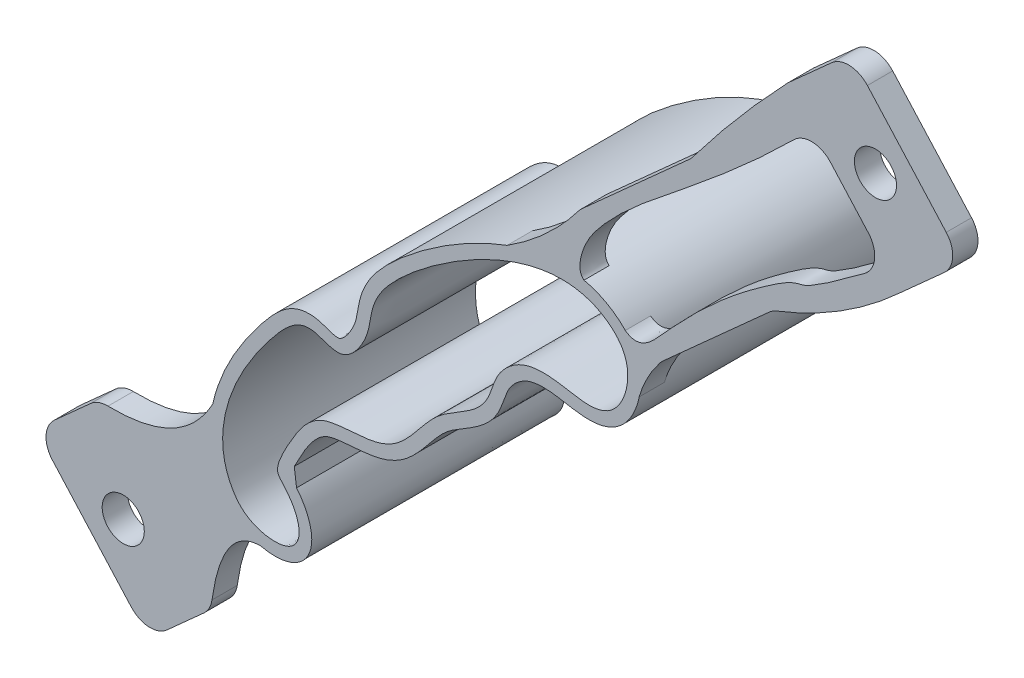
from build123d import *

# Parameters (mm, degrees)
AUFSATZ_LINEAR_AUSTRAGEN1_DEPTH = 30
SKIZZE4_R                       = 2.5
AUFSATZ_LINEAR_AUSTRAGEN2_DEPTH = 3
VERRUNDUNG3_R                   = 3
VERRUNDUNG4_R                   = 3
VERRUNDUNG5_START               = 27
VERRUNDUNG5_DEPTH               = 4


with BuildPart() as part:
    # Skizze1 → Aufsatz-Linear austragen1 (new body)
    with BuildSketch(Plane.XY):
        with BuildLine():
            Line((17.805483873, 75.346365063), (18.075577559, 73.275148617))
            add(Edge.make_bspline(
                [(17.805483873, 75.346365063), (17.901787388, 75.543952663), (18.098918872, 75.928420098), (18.531592516, 76.745922277), (19.053767391, 77.662901227), (19.685962473, 78.616842785), (20.310394137, 79.376011662), (20.917428897, 79.928504014), (21.492474627, 80.28589167), (22.109068164, 80.509254303), (23.080296979, 80.686536991), (24.274002487, 80.792069272), (25.639469144, 80.88753125), (27.13062438, 81.061916228), (28.733960632, 81.429483549), (30.390920227, 82.228106161), (31.667071802, 83.250840335), (32.715273654, 84.341017606), (33.90438164, 85.776346699), (35.21989003, 87.417041193), (36.388894712, 88.376958169), (37.828749756, 89.23417776), (39.042200601, 89.957344071), (40.332865121, 90.878925264), (41.378387834, 91.938856642), (42.076803149, 93.079988833), (42.41988679, 93.870983306), (42.670764701, 94.562859448), (42.87474209, 95.148772987), (43.055555842, 95.607525294), (43.288356196, 96.071310095), (43.700040542, 96.667894597), (44.313403567, 97.275033099), (45.004419797, 97.746706325), (45.686220273, 98.039769447), (46.733537315, 98.276019436), (48.06498212, 98.27185138), (49.645725432, 98.017934336), (51.110776669, 97.742231177), (52.784433655, 97.564727754), (54.439751425, 97.737840698), (55.851643862, 98.367684179), (57.087502619, 99.337094371), (58.089476068, 100.788884726), (58.77744943, 102.731587817), (58.937793672, 104.466388951), (58.765090388, 105.888534056), (58.432222636, 106.987744731), (57.91107896, 107.96268635), (57.085341572, 109.036026358), (55.970688846, 110.010762591), (54.555824749, 110.884812204), (53.032806254, 111.494601963), (50.944024423, 111.969000483), (48.291713956, 112.011252638), (45.144185458, 111.42403095), (42.059703724, 110.372227973), (38.088387574, 108.522190188), (33.528398131, 105.653716785), (29.258804569, 102.161178369), (27.169462549, 99.807184599), (26.139829606, 98.031380667), (25.661886766, 96.761270053), (25.418258003, 95.659338492), (25.233041872, 94.508783911), (25.043849953, 93.597827676), (24.323346092, 92.232835475), (23.646211225, 91.479948899), (23.296577273, 91.235583432), (23.123227372, 91.16685541), (23.080052081, 91.156135532), (22.971148478, 91.147507371), (22.71775014, 91.170129221), (22.420037015, 91.232610881), (22.02112936, 91.348290824), (21.439728086, 91.56192735), (20.319975171, 91.94215213), (18.533359684, 91.937418533), (16.906456684, 91.157887553), (15.583323175, 90.015658963), (14.178361442, 88.430542663), (12.443551899, 86.157895786), (10.677187512, 83.434272528), (9.244281861, 80.585632761), (8.205950778, 77.61119912), (7.786702128, 75.05742733), (7.808347555, 72.98945391), (8.032696812, 71.439764368), (8.413328925, 70.172194256), (8.84839224, 69.183752531), (9.354729082, 68.241171613), (10.09109392, 67.211309317), (11.187482131, 66.274817628), (12.532239947, 65.501001854), (13.948201625, 65.085459517), (15.430634646, 64.943914962), (16.587298552, 65.02136804), (17.636042911, 65.323546314), (18.512724633, 65.862353891), (19.137723882, 66.468854864), (19.610701751, 67.27724727), (19.904720592, 68.314381998), (19.892895413, 69.433557605), (19.62720783, 70.557548958), (19.210952041, 71.571661352), (18.77104499, 72.344471852), (18.357477737, 72.9260159), (18.174019412, 73.155724767), (18.075577559, 73.275148617)],
                knots=[0.512604297, 0.512604297, 0.512604297, 0.512604297, 0.516386221, 0.520168144, 0.527731992, 0.535295839, 0.542859686, 0.550423533, 0.557987381, 0.565551228, 0.573115075, 0.580678922, 0.58824277, 0.595806617, 0.603370464, 0.610934311, 0.618498159, 0.626062006, 0.633625853, 0.648753548, 0.663881242, 0.671445089, 0.679008937, 0.686572784, 0.694136631, 0.697918555, 0.701700478, 0.705482402, 0.709264326, 0.713046249, 0.716828173, 0.72439202, 0.731955867, 0.739519715, 0.747083562, 0.754647409, 0.769775104, 0.777338951, 0.784902798, 0.792466645, 0.800030493, 0.803812416, 0.80759434, 0.815158187, 0.822722034, 0.830285882, 0.834067805, 0.837849729, 0.841631653, 0.845413576, 0.852977423, 0.860541271, 0.868105118, 0.875668965, 0.89079666, 0.905924354, 0.921052049, 0.936179743, 0.966435132, 0.996690521, 1.02694591, 1.042073605, 1.057201299, 1.072328994, 1.087456688, 1.117712077, 1.147967466, 1.163095161, 1.178222855, 1.185786702, 1.19335055, 1.200914397, 1.208478244, 1.216042091, 1.223605939, 1.238733633, 1.253861328, 1.268989022, 1.284116717, 1.299244411, 1.314372106, 1.3294998, 1.344627495, 1.359755189, 1.374882884, 1.390010578, 1.397574425, 1.405138273, 1.41270212, 1.416484043, 1.420265967, 1.427829814, 1.431611738, 1.435393662, 1.442957509, 1.446739432, 1.450521356, 1.45430328, 1.456194242, 1.458085203, 1.459976165, 1.461867127, 1.465649051, 1.469430974, 1.473212898, 1.476994821, 1.478885783, 1.480776745, 1.480776745, 1.480776745, 1.480776745], degree=3))
        make_face()
        with BuildLine():
            add(Edge.make_bspline(
                [(30.233446723, 100.85101166), (29.190718101, 99.845008641), (27.765699565, 98.12645383), (26.936215872, 95.93535377), (26.769511384, 94.496146017), (26.52160366, 93.439814031), (26.068630401, 92.242965953), (25.249654064, 90.925989184), (24.269657958, 90.040562016), (23.650689888, 89.737001754), (23.19494828, 89.649334347), (22.644748797, 89.649713176), (21.887332557, 89.804985595), (21.124450197, 90.078494556), (20.287835153, 90.381594462), (19.171109962, 90.487227818), (17.982257511, 90.051113115), (16.846082884, 89.151249444), (15.53435029, 87.719466296), (13.83011404, 85.518132051), (12.063775475, 82.837237868), (10.650946038, 80.059543546), (9.651745831, 77.204790774), (9.201192972, 74.345819411), (9.396957061, 72.014438091), (9.988032593, 70.23378912), (10.637213627, 68.981161987), (11.641794285, 67.728214108), (13.263152214, 66.798679724), (14.815535673, 66.464214337), (16.039060928, 66.470178917), (16.924453393, 66.658751519), (17.790619508, 67.133799808), (18.365534145, 68.107408678), (18.412101029, 69.051577314), (18.244840981, 69.939334243), (17.91824725, 70.791351155), (17.479009049, 71.594269096), (16.95111228, 72.298581099), (16.463933023, 72.846487733), (16.084747463, 73.293634939), (15.88387409, 73.623826612), (15.824645547, 73.837560692), (15.816404613, 74.20229001), (15.912908348, 74.6794492), (16.170769348, 75.428392693), (16.697567965, 76.499933446), (17.39002436, 77.790610668), (18.323921033, 79.338878035), (19.334068193, 80.594466397), (20.456142208, 81.441830296), (21.653650593, 82.004197457), (23.681330256, 82.282305979), (26.04358602, 82.39634833), (27.929507931, 82.762544559), (29.318087614, 83.33890246), (30.472655664, 84.194343632), (31.789899452, 85.518938709), (32.914603711, 86.974583556), (34.064639599, 88.301439685), (34.958920289, 89.162802524), (35.976820988, 89.878480204), (37.14145258, 90.569458724), (38.342123511, 91.290612222), (39.498869063, 92.142849231), (40.345635916, 93.072353549), (40.845449209, 93.990433423), (41.20350496, 94.883013777), (41.543861114, 95.938704646), (42.038536602, 96.949210355), (42.760600152, 97.883218551), (43.928501206, 98.920925077), (45.580026595, 99.689675342), (47.522867565, 99.80795981), (49.247180718, 99.616760163), (50.656851813, 99.347806037), (52.149277438, 99.113967021), (53.436817064, 99.114424317), (54.475229345, 99.37965313), (55.490380949, 99.901029126), (56.454745031, 100.962161128), (57.16413879, 102.532256924), (57.456823643, 104.25926661), (57.269451624, 106.026090864), (56.422107963, 107.570403532), (55.286075865, 108.640053794), (54.070735412, 109.441423108), (52.748525558, 110.006760908), (50.89875978, 110.458620973), (48.47026287, 110.517941364), (45.475388666, 109.959560771), (42.46947693, 108.919928117), (38.550166207, 107.063182864), (34.022071296, 104.162471948), (31.276175345, 101.85701468), (30.233446723, 100.85101166)],
                knots=[0, 0, 0, 0, 0.03125, 0.0625, 0.09375, 0.109375, 0.125, 0.15625, 0.171875, 0.1875, 0.1953125, 0.203125, 0.21875, 0.234375, 0.25, 0.265625, 0.28125, 0.296875, 0.3125, 0.328125, 0.34375, 0.359375, 0.375, 0.390625, 0.40625, 0.4140625, 0.421875, 0.4296875, 0.4375, 0.4453125, 0.44921875, 0.453125, 0.45703125, 0.4609375, 0.46484375, 0.46875, 0.47265625, 0.4765625, 0.48046875, 0.484375, 0.48828125, 0.4921875, 0.49609375, 0.5, 0.50390625, 0.5078125, 0.515625, 0.5234375, 0.53125, 0.546875, 0.5546875, 0.5625, 0.578125, 0.59375, 0.6015625, 0.609375, 0.6171875, 0.625, 0.640625, 0.6484375, 0.65625, 0.6640625, 0.671875, 0.6796875, 0.6875, 0.6953125, 0.69921875, 0.703125, 0.7109375, 0.71875, 0.7265625, 0.734375, 0.75, 0.765625, 0.7734375, 0.78125, 0.7890625, 0.796875, 0.80078125, 0.8046875, 0.8125, 0.8203125, 0.828125, 0.8359375, 0.84375, 0.8515625, 0.859375, 0.8671875, 0.875, 0.890625, 0.90625, 0.921875, 0.9375, 0.96875, 1, 1, 1, 1], degree=3))
        make_face(mode=Mode.SUBTRACT)
    extrude(amount=AUFSATZ_LINEAR_AUSTRAGEN1_DEPTH)

    # Skizze4 → Aufsatz-Linear austragen2 (add)
    # profile 1 of 4: a face of its own
    with BuildSketch(Plane.XY.offset(30)):
        Polygon((83.818198518, 150.73431303), (76.378882662, 144.051755166), (79.297997504, 140.802068778), (88.114287377, 130.987389073), (89.743998389, 129.173123455), (97.183314245, 135.855681318), align=None)
        with Locations((86.781098454, 139.953718242)):
            Circle(SKIZZE4_R, mode=Mode.SUBTRACT)
    # profile 2 of 4: a face of its own
    with BuildSketch(Plane.XY.offset(30)):
        with BuildLine():
            add(Edge.make_bspline(
                [(8.144670001, 76.956852103), (7.972754635, 76.15805557), (7.788986714, 74.83916125), (7.808347555, 72.98945391), (8.032696812, 71.439764368), (8.413328925, 70.172194256), (8.84839224, 69.183752531), (9.354729082, 68.241171613), (10.09109392, 67.211309317), (11.187482131, 66.274817628), (12.365822878, 65.596763449), (13.245207715, 65.299509647), (13.786306878, 65.176574541)],
                knots=[1.378076215, 1.378076215, 1.378076215, 1.378076215, 1.390010578, 1.397574425, 1.405138273, 1.41270212, 1.416484043, 1.420265967, 1.427829814, 1.431611738, 1.435393662, 1.44108542, 1.44108542, 1.44108542, 1.44108542], degree=3))
            add(Edge.make_bspline(
                [(-5.453591751, 70.543618668), (4.384291904, 69.870217256), (8.144670001, 76.956852103)],
                knots=[0, 0, 0, 1, 1, 1], degree=2))
            Line((-5.453591751, 70.543618668), (-12.892907606, 63.861060804))
            Line((-12.892907606, 63.861060804), (0.472208121, 48.982429093))
            Line((0.472208121, 48.982429093), (7.911523976, 55.664986956))
            add(Edge.make_bspline(
                [(7.911523976, 55.664986956), (8.915723553, 65.154673095), (13.786306878, 65.176574541)],
                knots=[0, 0, 0, 0.871567029, 0.871567029, 0.871567029], degree=2))
        make_face()
        with Locations((-2.490691815, 59.76302388)):
            Circle(SKIZZE4_R, mode=Mode.SUBTRACT)
    # profile 3 of 4: a face of its own
    with BuildSketch(Plane.XY.offset(30)):
        with BuildLine():
            add(Edge.make_bspline(
                [(76.378882662, 144.051755166), (70.246641987, 137.617727628), (64.896553229, 130.534091812)],
                knots=[0, 0, 0, 1, 1, 1], degree=2))
            Line((64.896553229, 130.534091812), (51.710867524, 118.689708619))
            add(Edge.make_bspline(
                [(43.066941505, 110.693832545), (48.126710429, 113.879924511), (51.710867524, 118.689708619)],
                knots=[0, 0, 0, 1, 1, 1], degree=2))
            add(Edge.make_bspline(
                [(52.187605866, 111.676406194), (51.947106208, 111.730343095), (50.658218126, 111.973553469), (48.291713956, 112.011252638), (45.484820955, 111.487581939), (43.756596685, 110.94232592), (43.066941505, 110.693832545)],
                knots=[0.872180424, 0.872180424, 0.872180424, 0.872180424, 0.875668965, 0.89079666, 0.905924354, 0.916140548, 0.916140548, 0.916140548, 0.916140548], degree=3))
            add(Edge.make_bspline(
                [(79.297997504, 140.802068778), (74.505662276, 135.813077979), (66.20419418, 128.491817577), (55.73803799, 120.554649276), (51.866808115, 115.114639767), (51.51815201, 112.19774125), (52.187605866, 111.676406194)],
                knots=[0, 0, 0, 0, 0.486016573, 0.807459833, 0.910358537, 0.976774092, 0.976774092, 0.976774092, 0.976774092], degree=3))
            Line((79.297997504, 140.802068778), (76.378882662, 144.051755166))
        make_face()
    # profile 4 of 4: a face of its own
    with BuildSketch(Plane.XY.offset(30)):
        with BuildLine():
            Line((89.743998389, 129.173123455), (88.114287377, 130.987389073))
            add(Edge.make_bspline(
                [(88.114287377, 130.987389073), (79.034497618, 124.099265205), (77.576627315, 124.404928011), (69.92737845, 119.407044933), (64.227792013, 114.033646189), (58.836961994, 107.705880971), (57.09225424, 108.958225845)],
                knots=[0, 0, 0, 0, 0.095310797, 0.235441876, 0.798497489, 1, 1, 1, 1], degree=3))
            add(Edge.make_bspline(
                [(58.735074475, 102.9499077), (58.853048977, 103.559765265), (58.929446832, 104.535121969), (58.765090388, 105.888534056), (58.432222636, 106.987744731), (57.91107896, 107.96268635), (57.435694888, 108.580617366), (57.157411741, 108.888691154), (57.09225424, 108.958225845)],
                knots=[0.823453164, 0.823453164, 0.823453164, 0.823453164, 0.830285882, 0.834067805, 0.837849729, 0.841631653, 0.845413576, 0.846558872, 0.846558872, 0.846558872, 0.846558872], degree=3))
            add(Edge.make_bspline(
                [(61.394286378, 107.909702984), (59.541896122, 105.707576419), (58.735074475, 102.9499077)],
                knots=[0, 0, 0, 1, 1, 1], degree=2))
            Line((61.394286378, 107.909702984), (74.579972083, 119.754086178))
            add(Edge.make_bspline(
                [(89.743998389, 129.173123455), (83.039933912, 122.967192428), (74.579972083, 119.754086178)],
                knots=[0, 0, 0, 1, 1, 1], degree=2))
        make_face()
    extrude(amount=-AUFSATZ_LINEAR_AUSTRAGEN2_DEPTH)

    # Verrundung3
    verrundung3_edges = [part.edges().sort_by_distance(p)[0] for p in [
        (51.710867524, 118.689708619, 28.5),
        (64.896553229, 130.534091812, 28.5),
        (61.394286378, 107.909702984, 28.5),
        (74.579972083, 119.754086178, 28.5),
    ]]
    fillet(verrundung3_edges, radius=VERRUNDUNG3_R)

    # Verrundung4
    verrundung4_edges = [part.edges().sort_by_distance(p)[0] for p in [
        (88.114287377, 130.987389073, 28.5),
        (79.297997504, 140.802068778, 28.5),
    ]]
    fillet(verrundung4_edges, radius=VERRUNDUNG4_R)

    # Verrundung5: read off the stored shape, not the designer's step
    # Verrundung5 outline → Verrundung5 (cut)
    with BuildSketch(Plane.XY.offset(VERRUNDUNG5_START)):
        with BuildLine():
            Line((0.472208121, 48.982429093), (2.704002877, 50.987196452))
            ThreePointArc((2.704002877, 50.987196452), (0.538702906, 50.223289408), (-1.532559238, 51.21422385))
            Line((-1.532559238, 51.21422385), (0.472208121, 48.982429093))
        make_face()
        with BuildLine():
            ThreePointArc((8.041287423, 56.735903906), (7.71937482, 55.738481653), (7.074004399, 54.912663336))
            Line((7.074004399, 54.912663336), (7.911523976, 55.664986956))
            add(Edge.make_bspline(
                [(7.911523976, 55.664986956), (7.969877799, 56.216430589), (8.041287423, 56.735903906)],
                knots=[0, 0, 0, 0.050646574, 0.050646574, 0.050646574], degree=2))
        make_face()
        with BuildLine():
            Line((-12.892907606, 63.861060804), (-10.888140247, 61.629266048))
            ThreePointArc((-10.888140247, 61.629266048), (-11.652047292, 63.794566019), (-10.66111285, 65.865828163))
            Line((-10.66111285, 65.865828163), (-12.892907606, 63.861060804))
        make_face()
        with BuildLine():
            Line((-5.453591751, 70.543618668), (-6.366815147, 69.723292134))
            ThreePointArc((-6.366815147, 69.723292134), (-5.404649584, 70.304499599), (-4.296106819, 70.490772588))
            add(Edge.make_bspline(
                [(-5.453591751, 70.543618668), (-4.863932513, 70.503256596), (-4.296106819, 70.490772588)],
                knots=[0, 0, 0, 0.05993761, 0.05993761, 0.05993761], degree=2))
        make_face()
        with BuildLine():
            Line((97.183314245, 135.855681318), (95.178546886, 138.087476075))
            ThreePointArc((95.178546886, 138.087476075), (95.94245393, 135.922176103), (94.951519488, 133.850913959))
            Line((94.951519488, 133.850913959), (97.183314245, 135.855681318))
        make_face()
        with BuildLine():
            Line((83.818198518, 150.73431303), (81.586403761, 148.729545671))
            ThreePointArc((81.586403761, 148.729545671), (83.751703733, 149.493452715), (85.822965877, 148.502518273))
            Line((85.822965877, 148.502518273), (83.818198518, 150.73431303))
        make_face()
        with BuildLine():
            ThreePointArc((76.29744233, 143.966242015), (76.380060319, 144.049722526), (76.465882654, 144.129905159))
            Line((76.465882654, 144.129905159), (76.378882662, 144.051755166))
            add(Edge.make_bspline(
                [(76.378882662, 144.051755166), (76.338145237, 144.009012925), (76.29744233, 143.966242015)],
                knots=[0, 0, 0, 0.006643155, 0.006643155, 0.006643155], degree=2))
        make_face()
    extrude(amount=VERRUNDUNG5_DEPTH, mode=Mode.SUBTRACT)


solid = part.part
